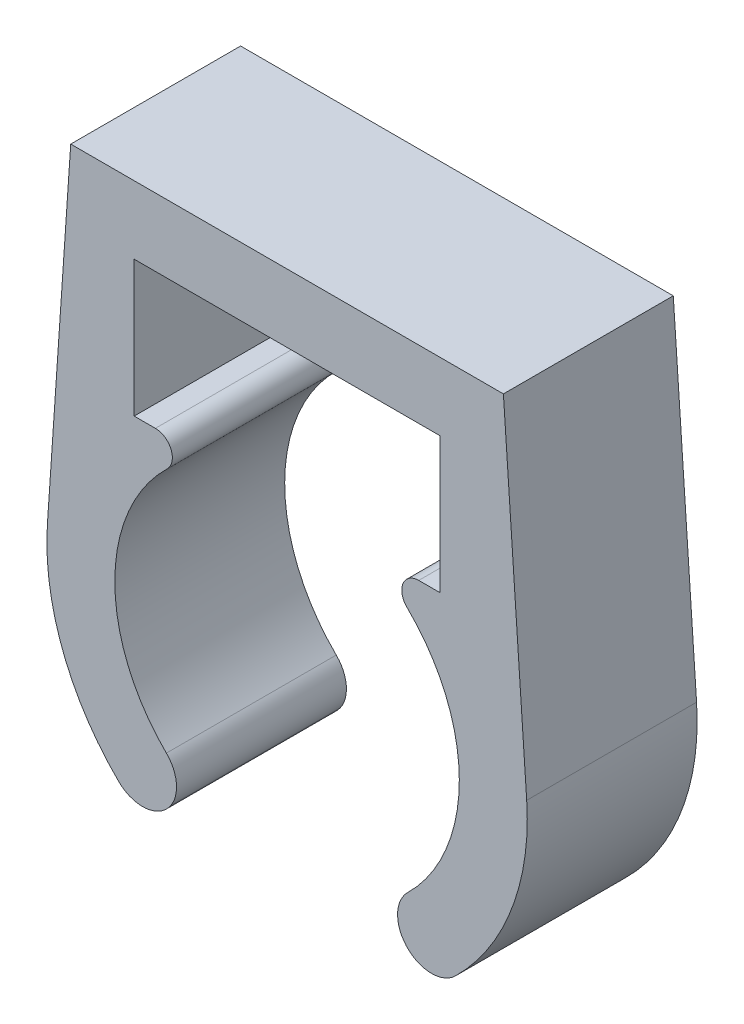
from build123d import *

# Parameters (mm, degrees)
BOSS_EXTRUDE1_DEPTH = 5
FILLET1_R           = 1
FILLET3_R           = 0.5


with BuildPart() as part:
    # Sketch1 → Boss-Extrude1 (new body)
    with BuildSketch(Plane.XY):
        with BuildLine():
            Line((-6.367771102, 10.5), (-7.053492803, 0.482844987))
            ThreePointArc((-7.053492803, 0.482844987), (-6.379046634, -3.048387121), (-4.055185405, -5.791404953))
            Line((-4.055185405, -5.791404953), (-2.908032532, -4.153100865))
            ThreePointArc((-2.908032532, -4.153100865), (-5.058941361, 0.334682398), (-2.335572735, 4.5))
            Line((-2.335572735, 4.5), (-4.5, 4.5))
            Line((-4.5, 4.5), (-4.5, 8.5))
            Line((-4.5, 8.5), (4.5, 8.5))
            Line((4.5, 8.5), (4.5, 4.5))
            Line((4.5, 4.5), (2.335572735, 4.5))
            ThreePointArc((2.335572735, 4.5), (4.332796658, 2.63282607), (5.07, 0))
            ThreePointArc((5.07, 0), (4.497144924, -2.341065469), (2.908032532, -4.153100865))
            Line((2.908032532, -4.153100865), (4.055185405, -5.791404953))
            ThreePointArc((4.055185405, -5.791404953), (6.379046634, -3.048387121), (7.053492803, 0.482844987))
            Line((7.053492803, 0.482844987), (6.367771102, 10.5))
            Line((6.367771102, 10.5), (-6.367771102, 10.5))
        make_face()
    extrude(amount=BOSS_EXTRUDE1_DEPTH)

    # Fillet1
    fillet1_edges = [part.edges().sort_by_distance(p)[0] for p in [
        (4.055185405, -5.791404953, 2.5),
        (2.908032532, -4.153100865, 2.5),
        (-4.055185405, -5.791404953, 2.5),
        (-2.908032532, -4.153100865, 2.5),
    ]]
    fillet(fillet1_edges, radius=FILLET1_R - 0.0001)  # a hair under: the kernel refuses the full size

    # Fillet3
    fillet3_edges = [part.edges().sort_by_distance(p)[0] for p in [
        (2.335572735, 4.5, 2.5),
        (-2.335572735, 4.5, 2.5),
    ]]
    fillet(fillet3_edges, radius=FILLET3_R)


solid = part.part
